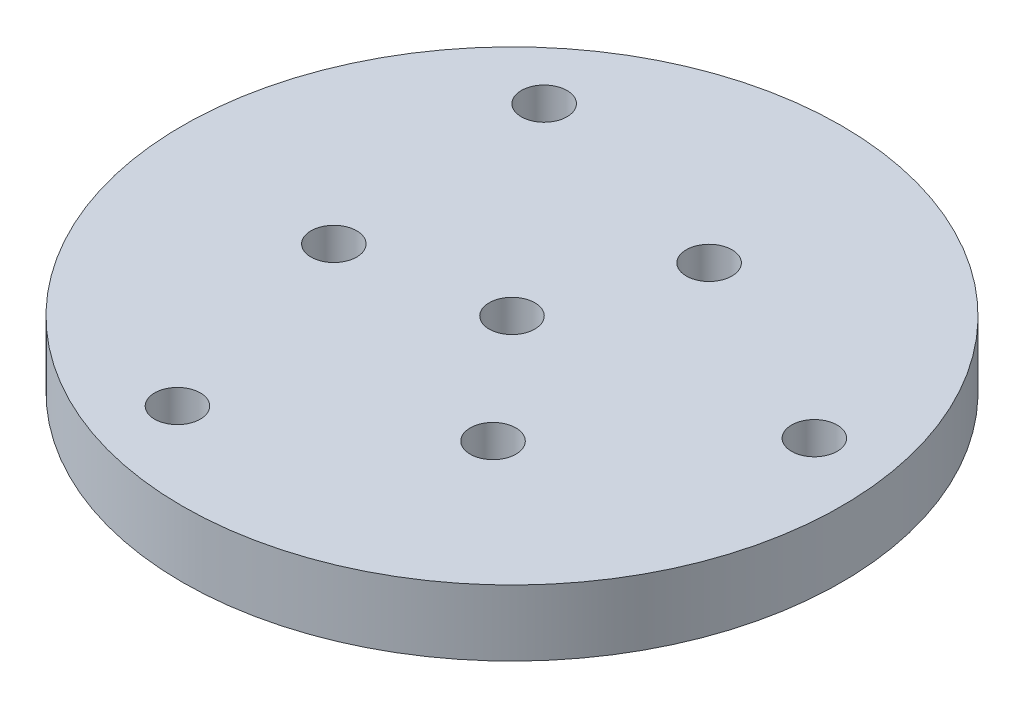
from build123d import *

# Parameters (mm, degrees)
SKETCH1_R           = 47.625
SKETCH1_R_2         = 3.3
BOSS_EXTRUDE1_DEPTH = 4.7625
SKETCH4_R           = 3.3
CUT_EXTRUDE2_DEPTH  = 69.022105782


with BuildPart() as part:
    # Sketch1 → Boss-Extrude1 (new, symmetric)
    with BuildSketch(Plane(origin=(0, 0, 0), x_dir=(1, 0, 0), z_dir=(0, 1, 0))):
        Circle(SKETCH1_R)
        Circle(SKETCH1_R_2, mode=Mode.SUBTRACT)
    extrude(amount=BOSS_EXTRUDE1_DEPTH, both=True)

    # Sketch4 → Cut-Extrude2 (cut, through all)
    with BuildSketch(Plane(origin=(0, 4.7625, 0), x_dir=(1, 0, 0), z_dir=(0, 1, 0))):
        with Locations((-12.900657786, -35.444265963)):
            Circle(SKETCH4_R)
        with Locations((-24.24530585, 28.89443035)):
            Circle(SKETCH4_R)
        with Locations((37.145963636, 6.549835613)):
            Circle(SKETCH4_R)
        with Locations((14.285954625, -17.025337748)):
            Circle(SKETCH4_R)
        with Locations((-21.887352311, -3.859330749)):
            Circle(SKETCH4_R)
        with Locations((7.601397685, 20.884668497)):
            Circle(SKETCH4_R)
    extrude(amount=-CUT_EXTRUDE2_DEPTH, mode=Mode.SUBTRACT)


solid = part.part
